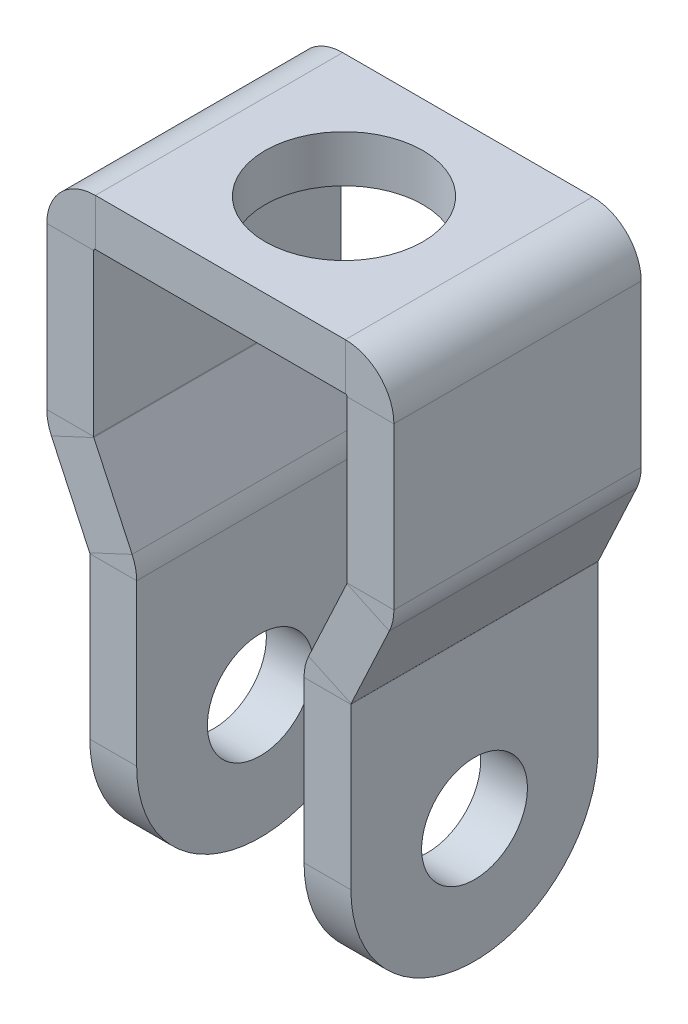
from build123d import *

# Parameters (mm, degrees)
ESBO_O1_W                      = 20
ESBO_O1_H                      = 14.25
FLANGE_BASE2_DEPTH             = 2.7
ARESTA_FLANGE1_STRIP_W         = 11
ARESTA_FLANGE1_STRIP_H         = 2.7
ARESTA_FLANGE1_STRIP_CUT_DEPTH = 14.25
ARESTA_FLANGE1_DEPTH           = 14.25
ARESTA_FLANGE4_START           = -7.125
ARESTA_FLANGE4_DEPTH           = 14.25
ARESTA_FLANGE4_2_DEPTH         = 14.25
ARESTA_FLANGE5_START           = -7.125
ARESTA_FLANGE5_DEPTH           = 14.25
ARESTA_FLANGE5_2_DEPTH         = 14.25
FILETE1_RADIUS                 = 7.125
FILETE1_LENGTH                 = 2.7
FILETE1_OF_ESPELHAR1_2_RADIUS  = 7.125
FILETE1_OF_ESPELHAR1_2_LENGTH  = 2.7
FURO_DE_DI_METRO_6_1_6_1_1_D   = 6.1
FURO_DE_DI_METRO_9_1_9_1_2_D   = 9.1


# Read off the part's stored shape, not the designer's step: Aresta-Flange4, Aresta-Flange5
# Sheet-metal steps are written as plain solids
with BuildPart() as part:
    # Esboço1 → Flange-base2 (new body)
    with BuildSketch(Plane(origin=(0, 0, 0), x_dir=(1, 0, 0), z_dir=(0, 1, 0))):
        Rectangle(ESBO_O1_W, ESBO_O1_H)
    extrude(amount=-FLANGE_BASE2_DEPTH)

    # Aresta-Flange1 strip (across the edge) → Aresta-Flange1 strip cut (cut)
    with BuildSketch(Plane(origin=(10, -2.7, -7.125), x_dir=(-1, 0, 0), z_dir=(0, 0, 1))):
        with Locations((-2.7, -1.35)):
            Rectangle(ARESTA_FLANGE1_STRIP_W, ARESTA_FLANGE1_STRIP_H)
    aresta_flange1_strip_cut = extrude(amount=ARESTA_FLANGE1_STRIP_CUT_DEPTH, mode=Mode.SUBTRACT)

    # Aresta-Flange1 section (across the edge) → Aresta-Flange1 (add)
    with BuildSketch(Plane(origin=(10, -2.7, -7.125), x_dir=(-1, 0, 0), z_dir=(0, 0, 1))):
        with BuildLine():
            Line((0, 0.1), (0, 15.8))
            Line((0, 15.8), (2.7, 15.8))
            Line((2.7, 15.8), (2.7, 0.1))
            ThreePointArc((2.7, 0.1), (2.729289322, 0.029289322), (2.8, 0))
            Line((2.8, 0), (2.8, -2.7))
            ThreePointArc((2.8, -2.7), (0.820101013, -1.879898987), (0, 0.1))
        make_face()
    aresta_flange1 = extrude(amount=ARESTA_FLANGE1_DEPTH)

    # Aresta-Flange4 outline → Aresta-Flange4 (cut)
    with BuildSketch(Plane.XY.offset(ARESTA_FLANGE4_START)):
        with BuildLine():
            ThreePointArc((10, -12.089086259), (9.93362882, -12.695117178), (9.737661804, -13.272417392))
            Line((9.737661804, -13.272417392), (7.3, -18.5))
            Line((7.3, -18.5), (10, -18.5))
            Line((10, -18.5), (10, -12.089086259))
        make_face()
    aresta_flange4 = extrude(amount=ARESTA_FLANGE4_DEPTH, mode=Mode.SUBTRACT)

    # Aresta-Flange4 2 outline → Aresta-Flange4 2 (add)
    with BuildSketch(Plane.XY.offset(ARESTA_FLANGE4_START)):
        with BuildLine():
            Line((4.822926294, -23.812101706), (7.3, -18.5))
            Line((7.3, -18.5), (7.3, -12.089086259))
            ThreePointArc((7.3, -12.089086259), (7.297629601, -12.11073022), (7.290630779, -12.131348085))
            Line((7.290630779, -12.131348085), (2.375895269, -22.671032399))
            Line((2.375895269, -22.671032399), (4.822926294, -23.812101706))
        make_face()
    aresta_flange4_2 = extrude(amount=ARESTA_FLANGE4_2_DEPTH)

    # Aresta-Flange5 outline → Aresta-Flange5 (cut)
    with BuildSketch(Plane.XY.offset(ARESTA_FLANGE5_START)):
        with BuildLine():
            Line((4.822926294, -23.812101706), (4.822926294, -18.044102487))
            ThreePointArc((4.822926294, -18.044102487), (4.889297474, -17.438071568), (5.08526449, -16.860771354))
            Line((5.08526449, -16.860771354), (2.375895269, -22.671032399))
            Line((2.375895269, -22.671032399), (4.822926294, -23.812101706))
        make_face()
    aresta_flange5 = extrude(amount=ARESTA_FLANGE5_DEPTH, mode=Mode.SUBTRACT)

    # Aresta-Flange5 2 outline → Aresta-Flange5 2 (add)
    with BuildSketch(Plane.XY.offset(ARESTA_FLANGE5_START)):
        with BuildLine():
            Line((7.532295515, -18.001840661), (4.822926294, -23.812101706))
            Line((4.822926294, -23.812101706), (4.822926294, -34.423357431))
            Line((4.822926294, -34.423357431), (7.522926294, -34.423357431))
            Line((7.522926294, -34.423357431), (7.522926294, -18.044102487))
            ThreePointArc((7.522926294, -18.044102487), (7.525296693, -18.022458526), (7.532295515, -18.001840661))
        make_face()
    aresta_flange5_2 = extrude(amount=ARESTA_FLANGE5_2_DEPTH)

    # Filete1: full round fillet: the end face becomes a half cylinder, R = half its width
    filete1_face = Plane((6.172926294, -34.423357431, 0), x_dir=(-1, 0, 0), z_dir=(0, -1, 0))  # on the end face: x along it, z out of the body
    filete1_slab = filete1_face.offset(-FILETE1_RADIUS / 2) * Box(FILETE1_LENGTH, 2 * FILETE1_RADIUS, FILETE1_RADIUS, mode=Mode.PRIVATE)  # the body's end, R deep
    filete1_round = Plane((6.172926294, -27.298357431, 0), x_dir=(0, -1, 0), z_dir=(-1, 0, 0)) * Cylinder(FILETE1_RADIUS, FILETE1_LENGTH, mode=Mode.PRIVATE)  # its axis R under the face
    add(filete1_slab - filete1_round, mode=Mode.SUBTRACT)

    # Espelhar1: Aresta-Flange1 strip cut, Aresta-Flange1, Aresta-Flange4, Aresta-Flange4 2, Aresta-Flange5, Aresta-Flange5 2 across plane
    add(aresta_flange1_strip_cut.mirror(Plane(origin=(0, 0, 0), x_dir=(0, 0, 1), z_dir=(1, 0, 0))), mode=Mode.SUBTRACT)
    add(aresta_flange1.mirror(Plane(origin=(0, 0, 0), x_dir=(0, 0, 1), z_dir=(1, 0, 0))))
    add(aresta_flange4.mirror(Plane(origin=(0, 0, 0), x_dir=(0, 0, 1), z_dir=(1, 0, 0))), mode=Mode.SUBTRACT)
    add(aresta_flange4_2.mirror(Plane(origin=(0, 0, 0), x_dir=(0, 0, 1), z_dir=(1, 0, 0))))
    add(aresta_flange5.mirror(Plane(origin=(0, 0, 0), x_dir=(0, 0, 1), z_dir=(1, 0, 0))), mode=Mode.SUBTRACT)
    add(aresta_flange5_2.mirror(Plane(origin=(0, 0, 0), x_dir=(0, 0, 1), z_dir=(1, 0, 0))))

    # Filete1 of Espelhar1 2: full round fillet: the end face becomes a half cylinder, R = half its width
    filete1_of_espelhar1_2_face = Plane((-6.172926294, -34.423357431, 0), x_dir=(1, 0, 0), z_dir=(0, -1, 0))  # on the end face: x along it, z out of the body
    filete1_of_espelhar1_2_slab = filete1_of_espelhar1_2_face.offset(-FILETE1_OF_ESPELHAR1_2_RADIUS / 2) * Box(FILETE1_OF_ESPELHAR1_2_LENGTH, 2 * FILETE1_OF_ESPELHAR1_2_RADIUS, FILETE1_OF_ESPELHAR1_2_RADIUS, mode=Mode.PRIVATE)  # the body's end, R deep
    filete1_of_espelhar1_2_round = Plane((-6.172926294, -27.298357431, 0), x_dir=(0, -1, 0), z_dir=(1, 0, 0)) * Cylinder(FILETE1_OF_ESPELHAR1_2_RADIUS, FILETE1_OF_ESPELHAR1_2_LENGTH, mode=Mode.PRIVATE)  # its axis R under the face
    add(filete1_of_espelhar1_2_slab - filete1_of_espelhar1_2_round, mode=Mode.SUBTRACT)

    # Furo de diâmetro Ø6.1 (6.1)1 (through all)
    with Locations(Plane(origin=(7.522926294, 0, 0), x_dir=(0, 0, -1), z_dir=(1, 0, 0))):
        with Locations((0, -27.298357431)):
            Hole(FURO_DE_DI_METRO_6_1_6_1_1_D / 2)

    # Furo de diâmetro Ø9.1 (9.1)2 (through all)
    with Locations(Plane(origin=(0, 0, 0), x_dir=(1, 0, 0), z_dir=(0, 1, 0))):
        with Locations((0, 0)):
            Hole(FURO_DE_DI_METRO_9_1_9_1_2_D / 2)


solid = part.part
